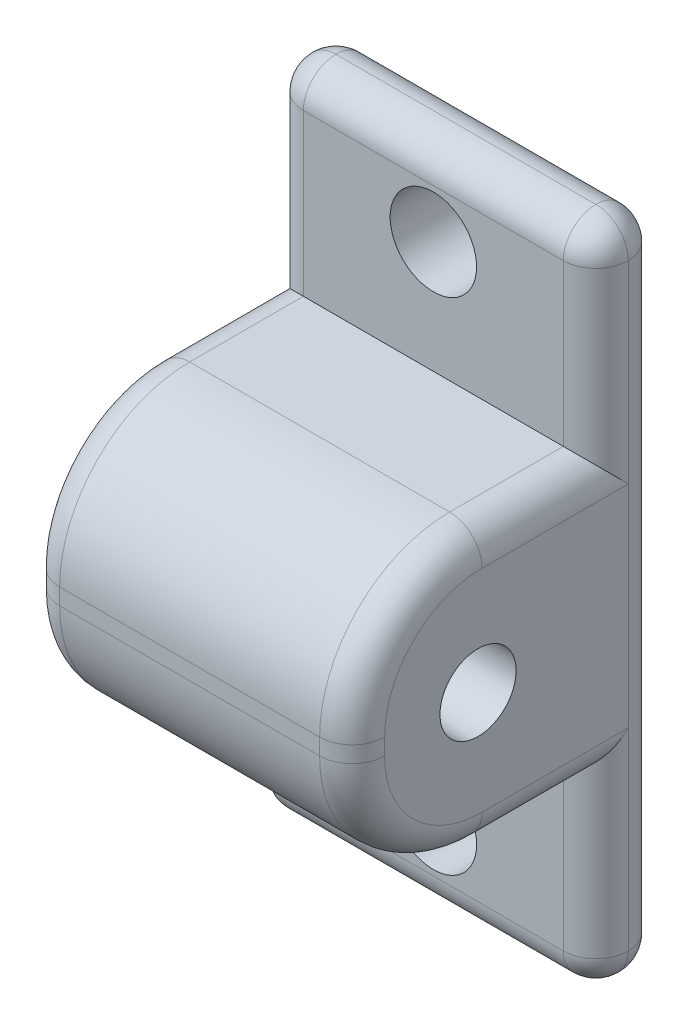
from build123d import *

# Parameters (mm, degrees)
BOSS_EXTRUDE1_DEPTH                  = 25.4
F_15_64_0_23438_DIAMETER_HOLE1_D     = 5.953252
F_15_64_0_23438_DIAMETER_HOLE1_DEPTH = 25.4
F_15_64_0_23438_DIAMETER_HOLE1_TIP   = 1.788537341
F_1_4_CLEARANCE_HOLE1_D              = 6.7564
F_1_4_CLEARANCE_HOLE1_DEPTH          = 25.4
F_1_4_CLEARANCE_HOLE1_TIP            = 2.029827343
FILLET1_R                            = 2.54


with BuildPart() as part:
    # Sketch1 → Boss-Extrude1 (new body)
    with BuildSketch(Plane(origin=(0, 0, 0), x_dir=(0, 0, -1), z_dir=(1, 0, 0))):
        with BuildLine():
            Line((0, 0), (0, 25.908))
            Line((0, 25.908), (-5.08, 25.908))
            Line((-5.08, 25.908), (-5.08, 10.795))
            Line((-5.08, 10.795), (-13.97, 10.795))
            ThreePointArc((-13.97, 10.795), (-21.154204897, 7.819204897), (-24.13, 0.635))
            Line((-24.13, 0.635), (-24.13, -0.635))
            ThreePointArc((-24.13, -0.635), (-21.154204897, -7.819204897), (-13.97, -10.795))
            Line((-13.97, -10.795), (-5.08, -10.795))
            Line((-5.08, -10.795), (-5.08, -25.908))
            Line((-5.08, -25.908), (0, -25.908))
            Line((0, -25.908), (0, 0))
        make_face()
    extrude(amount=-BOSS_EXTRUDE1_DEPTH)

    # 15/64 (0.23438) Diameter Hole1
    with Locations(Plane(origin=(0, 0, 0), x_dir=(0, 0, -1), z_dir=(1, 0, 0))):
        with Locations((-14.2875, 0)):
            Hole(F_15_64_0_23438_DIAMETER_HOLE1_D / 2, depth=F_15_64_0_23438_DIAMETER_HOLE1_DEPTH)
            with Locations((0, 0, -(F_15_64_0_23438_DIAMETER_HOLE1_DEPTH + F_15_64_0_23438_DIAMETER_HOLE1_TIP / 2))):  # 118° drill point
                Cone(0, F_15_64_0_23438_DIAMETER_HOLE1_D / 2, F_15_64_0_23438_DIAMETER_HOLE1_TIP, mode=Mode.SUBTRACT)

    # 1/4 Clearance Hole1
    with Locations(Plane.XY.offset(5.08)):
        with Locations((-12.7, 19.558), (-12.7, -19.558)):
            Hole(F_1_4_CLEARANCE_HOLE1_D / 2, depth=F_1_4_CLEARANCE_HOLE1_DEPTH)
            with Locations((0, 0, -(F_1_4_CLEARANCE_HOLE1_DEPTH + F_1_4_CLEARANCE_HOLE1_TIP / 2))):  # 118° drill point
                Cone(0, F_1_4_CLEARANCE_HOLE1_D / 2, F_1_4_CLEARANCE_HOLE1_TIP, mode=Mode.SUBTRACT)

    # Fillet1
    fillet1_edges = [part.edges().sort_by_distance(p)[0] for p in [
        (0, -10.795, 9.525),
        (-25.4, -10.795, 9.525),
        (0, -7.819204897, 21.154204897),
        (-25.4, -7.819204897, 21.154204897),
        (0, -18.3515, 5.08),
        (-12.7, -25.908, 5.08),
        (0, 0, 24.13),
        (0, -25.908, 2.54),
        (0, 7.819204897, 21.154204897),
        (0, 0, 0),
        (0, 10.795, 9.525),
        (0, 25.908, 2.54),
        (0, 18.3515, 5.08),
        (-25.4, -25.908, 2.54),
        (-25.4, 0, 0),
        (-25.4, 25.908, 2.54),
        (-25.4, 18.3515, 5.08),
        (-25.4, 10.795, 9.525),
        (-25.4, 7.819204897, 21.154204897),
        (-25.4, 0, 24.13),
        (-12.7, -25.908, 0),
        (-12.7, 25.908, 0),
        (-12.7, 25.908, 5.08),
    ]]
    fillet(fillet1_edges, radius=FILLET1_R - 0.0001)  # a hair under: the kernel refuses the full size


solid = part.part
